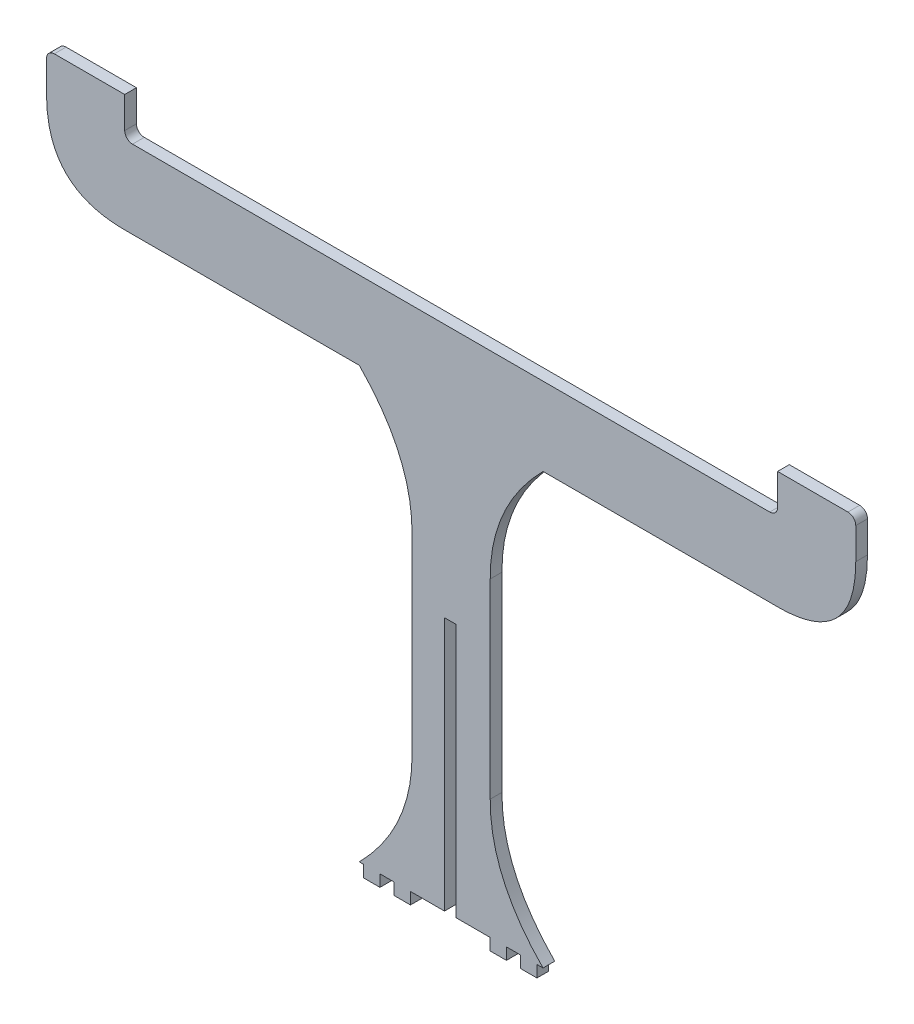
from build123d import *

# Parameters (mm, degrees)
P_IDAT_VYSUNUT_M2_DEPTH  = 3
SKICA2_W                 = 3
SKICA2_H                 = 65
ODEBRAT_VYSUNUT_M3_DEPTH = 3


with BuildPart() as part:
    # Skica1 → Přidat vysunutím2 (new body)
    with BuildSketch(Plane.XY):
        with BuildLine():
            Line((-90.642636358, 2.694256757), (-30.642636358, 2.694256757))
            add(Edge.make_bspline(
                [(-30.642636358, 2.694256757), (-17.025139471, -11.118063286), (-17.142636358, -27.878389443)],
                knots=[0, 0, 0, 1, 1, 1], degree=2))
            Line((-17.142636358, -27.878389443), (-17.142636358, -76.655981804))
            add(Edge.make_bspline(
                [(-30.642636358, -107.305743243), (-17.009316786, -93.458261678), (-17.142636358, -76.655981804)],
                knots=[0, 0, 0, 1, 1, 1], degree=2))
            Line((-30.642636358, -107.305743243), (-29.497972973, -107.305743243))
            Line((-29.497972973, -107.305743243), (-29.497972973, -110.305743243))
            Line((-29.497972973, -110.305743243), (-25.347972973, -110.305743243))
            Line((-25.347972973, -110.305743243), (-25.347972973, -107.305743243))
            Line((-25.347972973, -107.305743243), (-21.697972973, -107.305743243))
            Line((-21.697972973, -107.305743243), (-21.697972973, -110.305743243))
            Line((-21.697972973, -110.305743243), (-17.547972973, -110.305743243))
            Line((-17.547972973, -110.305743243), (-17.547972973, -107.305743243))
            Line((-17.547972973, -107.305743243), (2.852027027, -107.305743243))
            Line((2.852027027, -107.305743243), (2.852027027, -110.305743243))
            Line((2.852027027, -110.305743243), (7.002027027, -110.305743243))
            Line((7.002027027, -110.305743243), (7.002027027, -107.305743243))
            Line((7.002027027, -107.305743243), (10.652027027, -107.305743243))
            Line((10.652027027, -107.305743243), (10.652027027, -110.305743243))
            Line((10.652027027, -110.305743243), (14.802027027, -110.305743243))
            Line((14.802027027, -110.305743243), (14.802027027, -107.305743243))
            Line((14.802027027, -107.305743243), (16.357363642, -107.305743243))
            add(Edge.make_bspline(
                [(16.357363642, -107.305743243), (2.72404407, -93.458261678), (2.857363642, -76.655981804)],
                knots=[0, 0, 0, 1, 1, 1], degree=2))
            Line((2.857363642, -76.655981804), (2.857363642, -27.878389443))
            add(Edge.make_bspline(
                [(16.357363642, 2.694256757), (2.739866756, -11.118063286), (2.857363642, -27.878389443)],
                knots=[0, 0, 0, 1, 1, 1], degree=2))
            Line((16.357363642, 2.694256757), (76.357363642, 2.694256757))
            add(Edge.make_bspline(
                [(96.357363642, 22.694256757), (96.357363642, 2.694256757), (76.357363642, 2.694256757)],
                knots=[0, 0, 0, 1, 1, 1], degree=2))
            Line((96.357363642, 22.694256757), (96.357363642, 30.694256757))
            ThreePointArc((96.357363642, 30.694256757), (95.771577204, 32.108470319), (94.357363642, 32.694256757))
            Line((94.357363642, 32.694256757), (76.357363642, 32.694256757))
            Line((76.357363642, 32.694256757), (76.357363642, 24.694256757))
            ThreePointArc((76.357363642, 24.694256757), (75.771577204, 23.280043194), (74.357363642, 22.694256757))
            Line((74.357363642, 22.694256757), (-88.642636358, 22.694256757))
            ThreePointArc((-88.642636358, 22.694256757), (-90.05684992, 23.280043194), (-90.642636358, 24.694256757))
            Line((-90.642636358, 24.694256757), (-90.642636358, 32.694256757))
            Line((-90.642636358, 32.694256757), (-108.642636358, 32.694256757))
            ThreePointArc((-108.642636358, 32.694256757), (-110.05684992, 32.108470319), (-110.642636358, 30.694256757))
            Line((-110.642636358, 30.694256757), (-110.642636358, 22.694256757))
            add(Edge.make_bspline(
                [(-110.642636358, 22.694256757), (-110.642636358, 2.694256757), (-90.642636358, 2.694256757)],
                knots=[0, 0, 0, 1, 1, 1], degree=2))
        make_face()
    extrude(amount=P_IDAT_VYSUNUT_M2_DEPTH)

    # Skica2 → Odebrat vysunutím3 (cut)
    with BuildSketch(Plane(origin=(0, 0, 0), x_dir=(-1, 0, 0), z_dir=(0, 0, -1))):
        with Locations((7.347972973, -74.805743243)):
            Rectangle(SKICA2_W, SKICA2_H)
    extrude(amount=-ODEBRAT_VYSUNUT_M3_DEPTH, mode=Mode.SUBTRACT)


solid = part.part
